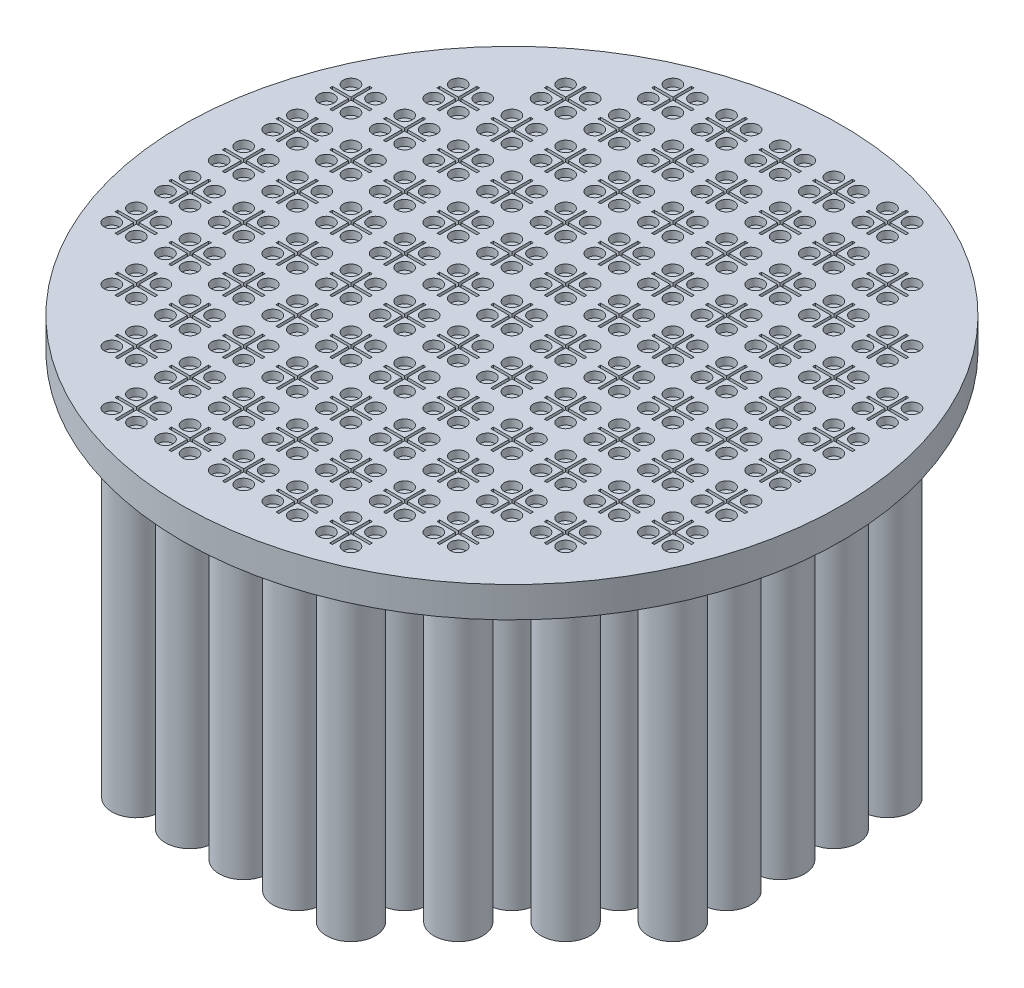
from build123d import *

# Parameters (mm, degrees)
SKETCH_1_R               = 2150
EXTRUDE_1_DEPTH          = 100
SKETCH_3_R               = 140
CUT_EXTRUDE_1_DEPTH      = 3043.203149035
EXTRUDE_START            = 2000
SKETCH_7_R               = 160
SKETCH_7_R_2             = 140
EXTRUDE_3_DEPTH          = 2000
PATTERN_CIRCULAR_1_COUNT = 4
EXTRUDE_START_2          = 100
SKETCH_4_R               = 2150
EXTRUDE_2_DEPTH          = 100
SKETCH_5_W               = 260
SKETCH_5_H               = 17.5
CUT_EXTRUDE_2_DEPTH      = 3755.330832519
SKETCH_6_W               = 17.5
SKETCH_6_H               = 260
CUT_EXTRUDE_3_DEPTH      = 3696.26724338
SKETCH_8_R               = 50
CUT_EXTRUDE_4_DEPTH      = 50
PATTERN_CIRCULAR_3_COUNT = 4


with BuildPart() as part:
    # ｽｹｯﾁ1 → ﾎﾞｽ - 押し出し1 (new body)
    with BuildSketch(Plane(origin=(0, 0, 0), x_dir=(1, 0, 0), z_dir=(0, 1, 0))):
        with Locations(Location((0, 0, 0), (0, 0, 270))):
            Circle(SKETCH_1_R)
    extrude(amount=-EXTRUDE_1_DEPTH)

    # ｽｹｯﾁ3 → ｶｯﾄ - 押し出し1 (cut, through all)
    with BuildSketch(Plane(origin=(0, -100, 0), x_dir=(-1, 0, 0), z_dir=(0, -1, 0))):
        with Locations(Location((0, 0, 0), (0, 0, 90))):
            Circle(SKETCH_3_R)
        with Locations(Location((350, 0, 0), (0, 0, 90))):
            Circle(SKETCH_3_R)
        with Locations(Location((700, 0, 0), (0, 0, 90))):
            Circle(SKETCH_3_R)
        with Locations(Location((1050, 0, 0), (0, 0, 90))):
            Circle(SKETCH_3_R)
        with Locations(Location((1400, 0, 0), (0, 0, 90))):
            Circle(SKETCH_3_R)
        with Locations(Location((1750, 0, 0), (0, 0, 90))):
            Circle(SKETCH_3_R)
        with Locations(Location((350, 350, 0), (0, 0, 90))):
            Circle(SKETCH_3_R)
        with Locations(Location((700, 350, 0), (0, 0, 90))):
            Circle(SKETCH_3_R)
        with Locations(Location((1050, 350, 0), (0, 0, 90))):
            Circle(SKETCH_3_R)
        with Locations(Location((1400, 350, 0), (0, 0, 90))):
            Circle(SKETCH_3_R)
        with Locations(Location((1750, 350, 0), (0, 0, 90))):
            Circle(SKETCH_3_R)
        with Locations(Location((350, 700, 0), (0, 0, 90))):
            Circle(SKETCH_3_R)
        with Locations(Location((700, 700, 0), (0, 0, 90))):
            Circle(SKETCH_3_R)
        with Locations(Location((1050, 700, 0), (0, 0, 90))):
            Circle(SKETCH_3_R)
        with Locations(Location((1400, 700, 0), (0, 0, 90))):
            Circle(SKETCH_3_R)
        with Locations(Location((1750, 700, 0), (0, 0, 90))):
            Circle(SKETCH_3_R)
        with Locations(Location((350, 1050, 0), (0, 0, 90))):
            Circle(SKETCH_3_R)
        with Locations(Location((700, 1050, 0), (0, 0, 90))):
            Circle(SKETCH_3_R)
        with Locations(Location((1050, 1050, 0), (0, 0, 90))):
            Circle(SKETCH_3_R)
        with Locations(Location((1400, 1050, 0), (0, 0, 90))):
            Circle(SKETCH_3_R)
        with Locations(Location((350, 1400, 0), (0, 0, 90))):
            Circle(SKETCH_3_R)
        with Locations(Location((700, 1400, 0), (0, 0, 90))):
            Circle(SKETCH_3_R)
        with Locations(Location((1050, 1400, 0), (0, 0, 90))):
            Circle(SKETCH_3_R)
        with Locations(Location((350, 1750, 0), (0, 0, 90))):
            Circle(SKETCH_3_R)
        with Locations(Location((700, 1750, 0), (0, 0, 90))):
            Circle(SKETCH_3_R)
        with Locations(Location((0, 350, 0), (0, 0, 90))):
            Circle(SKETCH_3_R)
        with Locations(Location((0, 700, 0), (0, 0, 90))):
            Circle(SKETCH_3_R)
        with Locations(Location((0, 1050, 0), (0, 0, 90))):
            Circle(SKETCH_3_R)
        with Locations(Location((0, 1400, 0), (0, 0, 90))):
            Circle(SKETCH_3_R)
        with Locations(Location((0, 1750, 0), (0, 0, 90))):
            Circle(SKETCH_3_R)
    cut_extrude_1 = extrude(amount=-CUT_EXTRUDE_1_DEPTH, mode=Mode.SUBTRACT)

    # ｽｹｯﾁ7 → ﾎﾞｽ - 押し出し3 (add)
    # profile 1 of 30: a face of its own
    with BuildSketch(Plane.XZ.offset(100).offset(EXTRUDE_START)):
        with Locations(Location((0, 0, 0), (0, 0, 90))):
            Circle(SKETCH_7_R)
        with Locations(Location((0, 0, 0), (0, 0, 270))):
            Circle(SKETCH_7_R_2, mode=Mode.SUBTRACT)
    # profile 2 of 30: a face of its own
    with BuildSketch(Plane.XZ.offset(100).offset(EXTRUDE_START)):
        with Locations(Location((-350, 0, 0), (0, 0, 90))):
            Circle(SKETCH_7_R)
        with Locations(Location((-350, 0, 0), (0, 0, 270))):
            Circle(SKETCH_7_R_2, mode=Mode.SUBTRACT)
    # profile 3 of 30: a face of its own
    with BuildSketch(Plane.XZ.offset(100).offset(EXTRUDE_START)):
        with Locations(Location((-700, 0, 0), (0, 0, 90))):
            Circle(SKETCH_7_R)
        with Locations(Location((-700, 0, 0), (0, 0, 270))):
            Circle(SKETCH_7_R_2, mode=Mode.SUBTRACT)
    # profile 4 of 30: a face of its own
    with BuildSketch(Plane.XZ.offset(100).offset(EXTRUDE_START)):
        with Locations(Location((-1050, 0, 0), (0, 0, 90))):
            Circle(SKETCH_7_R)
        with Locations(Location((-1050, 0, 0), (0, 0, 270))):
            Circle(SKETCH_7_R_2, mode=Mode.SUBTRACT)
    # profile 5 of 30: a face of its own
    with BuildSketch(Plane.XZ.offset(100).offset(EXTRUDE_START)):
        with Locations(Location((-1400, 0, 0), (0, 0, 90))):
            Circle(SKETCH_7_R)
        with Locations(Location((-1400, 0, 0), (0, 0, 270))):
            Circle(SKETCH_7_R_2, mode=Mode.SUBTRACT)
    # profile 6 of 30: a face of its own
    with BuildSketch(Plane.XZ.offset(100).offset(EXTRUDE_START)):
        with Locations(Location((-1750, 0, 0), (0, 0, 90))):
            Circle(SKETCH_7_R)
        with Locations(Location((-1750, 0, 0), (0, 0, 270))):
            Circle(SKETCH_7_R_2, mode=Mode.SUBTRACT)
    # profile 7 of 30: a face of its own
    with BuildSketch(Plane.XZ.offset(100).offset(EXTRUDE_START)):
        with Locations(Location((-350, -350, 0), (0, 0, 90))):
            Circle(SKETCH_7_R)
        with Locations(Location((-350, -350, 0), (0, 0, 270))):
            Circle(SKETCH_7_R_2, mode=Mode.SUBTRACT)
    # profile 8 of 30: a face of its own
    with BuildSketch(Plane.XZ.offset(100).offset(EXTRUDE_START)):
        with Locations(Location((-700, -350, 0), (0, 0, 90))):
            Circle(SKETCH_7_R)
        with Locations(Location((-700, -350, 0), (0, 0, 270))):
            Circle(SKETCH_7_R_2, mode=Mode.SUBTRACT)
    # profile 9 of 30: a face of its own
    with BuildSketch(Plane.XZ.offset(100).offset(EXTRUDE_START)):
        with Locations(Location((-1050, -350, 0), (0, 0, 90))):
            Circle(SKETCH_7_R)
        with Locations(Location((-1050, -350, 0), (0, 0, 270))):
            Circle(SKETCH_7_R_2, mode=Mode.SUBTRACT)
    # profile 10 of 30: a face of its own
    with BuildSketch(Plane.XZ.offset(100).offset(EXTRUDE_START)):
        with Locations(Location((-1400, -350, 0), (0, 0, 90))):
            Circle(SKETCH_7_R)
        with Locations(Location((-1400, -350, 0), (0, 0, 270))):
            Circle(SKETCH_7_R_2, mode=Mode.SUBTRACT)
    # profile 11 of 30: a face of its own
    with BuildSketch(Plane.XZ.offset(100).offset(EXTRUDE_START)):
        with Locations(Location((-1750, -350, 0), (0, 0, 90))):
            Circle(SKETCH_7_R)
        with Locations(Location((-1750, -350, 0), (0, 0, 270))):
            Circle(SKETCH_7_R_2, mode=Mode.SUBTRACT)
    # profile 12 of 30: a face of its own
    with BuildSketch(Plane.XZ.offset(100).offset(EXTRUDE_START)):
        with Locations(Location((-350, -700, 0), (0, 0, 90))):
            Circle(SKETCH_7_R)
        with Locations(Location((-350, -700, 0), (0, 0, 270))):
            Circle(SKETCH_7_R_2, mode=Mode.SUBTRACT)
    # profile 13 of 30: a face of its own
    with BuildSketch(Plane.XZ.offset(100).offset(EXTRUDE_START)):
        with Locations(Location((-700, -700, 0), (0, 0, 90))):
            Circle(SKETCH_7_R)
        with Locations(Location((-700, -700, 0), (0, 0, 270))):
            Circle(SKETCH_7_R_2, mode=Mode.SUBTRACT)
    # profile 14 of 30: a face of its own
    with BuildSketch(Plane.XZ.offset(100).offset(EXTRUDE_START)):
        with Locations(Location((-1050, -700, 0), (0, 0, 90))):
            Circle(SKETCH_7_R)
        with Locations(Location((-1050, -700, 0), (0, 0, 270))):
            Circle(SKETCH_7_R_2, mode=Mode.SUBTRACT)
    # profile 15 of 30: a face of its own
    with BuildSketch(Plane.XZ.offset(100).offset(EXTRUDE_START)):
        with Locations(Location((-1400, -700, 0), (0, 0, 90))):
            Circle(SKETCH_7_R)
        with Locations(Location((-1400, -700, 0), (0, 0, 270))):
            Circle(SKETCH_7_R_2, mode=Mode.SUBTRACT)
    # profile 16 of 30: a face of its own
    with BuildSketch(Plane.XZ.offset(100).offset(EXTRUDE_START)):
        with Locations(Location((-1750, -700, 0), (0, 0, 90))):
            Circle(SKETCH_7_R)
        with Locations(Location((-1750, -700, 0), (0, 0, 270))):
            Circle(SKETCH_7_R_2, mode=Mode.SUBTRACT)
    # profile 17 of 30: a face of its own
    with BuildSketch(Plane.XZ.offset(100).offset(EXTRUDE_START)):
        with Locations(Location((-350, -1050, 0), (0, 0, 90))):
            Circle(SKETCH_7_R)
        with Locations(Location((-350, -1050, 0), (0, 0, 270))):
            Circle(SKETCH_7_R_2, mode=Mode.SUBTRACT)
    # profile 18 of 30: a face of its own
    with BuildSketch(Plane.XZ.offset(100).offset(EXTRUDE_START)):
        with Locations(Location((-700, -1050, 0), (0, 0, 90))):
            Circle(SKETCH_7_R)
        with Locations(Location((-700, -1050, 0), (0, 0, 270))):
            Circle(SKETCH_7_R_2, mode=Mode.SUBTRACT)
    # profile 19 of 30: a face of its own
    with BuildSketch(Plane.XZ.offset(100).offset(EXTRUDE_START)):
        with Locations(Location((-1050, -1050, 0), (0, 0, 90))):
            Circle(SKETCH_7_R)
        with Locations(Location((-1050, -1050, 0), (0, 0, 270))):
            Circle(SKETCH_7_R_2, mode=Mode.SUBTRACT)
    # profile 20 of 30: a face of its own
    with BuildSketch(Plane.XZ.offset(100).offset(EXTRUDE_START)):
        with Locations(Location((-1400, -1050, 0), (0, 0, 90))):
            Circle(SKETCH_7_R)
        with Locations(Location((-1400, -1050, 0), (0, 0, 270))):
            Circle(SKETCH_7_R_2, mode=Mode.SUBTRACT)
    # profile 21 of 30: a face of its own
    with BuildSketch(Plane.XZ.offset(100).offset(EXTRUDE_START)):
        with Locations(Location((-350, -1400, 0), (0, 0, 90))):
            Circle(SKETCH_7_R)
        with Locations(Location((-350, -1400, 0), (0, 0, 270))):
            Circle(SKETCH_7_R_2, mode=Mode.SUBTRACT)
    # profile 22 of 30: a face of its own
    with BuildSketch(Plane.XZ.offset(100).offset(EXTRUDE_START)):
        with Locations(Location((-700, -1400, 0), (0, 0, 90))):
            Circle(SKETCH_7_R)
        with Locations(Location((-700, -1400, 0), (0, 0, 270))):
            Circle(SKETCH_7_R_2, mode=Mode.SUBTRACT)
    # profile 23 of 30: a face of its own
    with BuildSketch(Plane.XZ.offset(100).offset(EXTRUDE_START)):
        with Locations(Location((-1050, -1400, 0), (0, 0, 90))):
            Circle(SKETCH_7_R)
        with Locations(Location((-1050, -1400, 0), (0, 0, 270))):
            Circle(SKETCH_7_R_2, mode=Mode.SUBTRACT)
    # profile 24 of 30: a face of its own
    with BuildSketch(Plane.XZ.offset(100).offset(EXTRUDE_START)):
        with Locations(Location((-350, -1750, 0), (0, 0, 90))):
            Circle(SKETCH_7_R)
        with Locations(Location((-350, -1750, 0), (0, 0, 270))):
            Circle(SKETCH_7_R_2, mode=Mode.SUBTRACT)
    # profile 25 of 30: a face of its own
    with BuildSketch(Plane.XZ.offset(100).offset(EXTRUDE_START)):
        with Locations(Location((-700, -1750, 0), (0, 0, 90))):
            Circle(SKETCH_7_R)
        with Locations(Location((-700, -1750, 0), (0, 0, 270))):
            Circle(SKETCH_7_R_2, mode=Mode.SUBTRACT)
    # profile 26 of 30: a face of its own
    with BuildSketch(Plane.XZ.offset(100).offset(EXTRUDE_START)):
        with Locations(Location((0, -350, 0), (0, 0, 90))):
            Circle(SKETCH_7_R)
        with Locations(Location((0, -350, 0), (0, 0, 270))):
            Circle(SKETCH_7_R_2, mode=Mode.SUBTRACT)
    # profile 27 of 30: a face of its own
    with BuildSketch(Plane.XZ.offset(100).offset(EXTRUDE_START)):
        with Locations(Location((0, -700, 0), (0, 0, 90))):
            Circle(SKETCH_7_R)
        with Locations(Location((0, -700, 0), (0, 0, 270))):
            Circle(SKETCH_7_R_2, mode=Mode.SUBTRACT)
    # profile 28 of 30: a face of its own
    with BuildSketch(Plane.XZ.offset(100).offset(EXTRUDE_START)):
        with Locations(Location((0, -1050, 0), (0, 0, 90))):
            Circle(SKETCH_7_R)
        with Locations(Location((0, -1050, 0), (0, 0, 270))):
            Circle(SKETCH_7_R_2, mode=Mode.SUBTRACT)
    # profile 29 of 30: a face of its own
    with BuildSketch(Plane.XZ.offset(100).offset(EXTRUDE_START)):
        with Locations(Location((0, -1400, 0), (0, 0, 90))):
            Circle(SKETCH_7_R)
        with Locations(Location((0, -1400, 0), (0, 0, 270))):
            Circle(SKETCH_7_R_2, mode=Mode.SUBTRACT)
    # profile 30 of 30: a face of its own
    with BuildSketch(Plane.XZ.offset(100).offset(EXTRUDE_START)):
        with Locations(Location((0, -1750, 0), (0, 0, 90))):
            Circle(SKETCH_7_R)
        with Locations(Location((0, -1750, 0), (0, 0, 270))):
            Circle(SKETCH_7_R_2, mode=Mode.SUBTRACT)
    extrude_3 = extrude(amount=-EXTRUDE_3_DEPTH)

    # 円形ﾊﾟﾀｰﾝ1: ｶｯﾄ - 押し出し1, ﾎﾞｽ - 押し出し3 ×4 about axis
    pattern_circular_1_axis = Axis((0, 0, 0), (0, 1, 0))
    add([cut_extrude_1.rotate(pattern_circular_1_axis, i * 360 / PATTERN_CIRCULAR_1_COUNT) for i in range(1, PATTERN_CIRCULAR_1_COUNT)], mode=Mode.SUBTRACT)
    add([extrude_3.rotate(pattern_circular_1_axis, i * 360 / PATTERN_CIRCULAR_1_COUNT) for i in range(1, PATTERN_CIRCULAR_1_COUNT)])

    # ｽｹｯﾁ4 → ﾎﾞｽ - 押し出し2 (add)
    with BuildSketch(Plane(origin=(0, 0, 0), x_dir=(1, 0, 0), z_dir=(0, 1, 0)).offset(EXTRUDE_START_2)):
        with Locations(Location((0, 0, 0), (0, 0, 270))):
            Circle(SKETCH_4_R)
    extrude(amount=-EXTRUDE_2_DEPTH)

    # ｽｹｯﾁ5 → ｶｯﾄ - 押し出し2 (cut, through all)
    with BuildSketch(Plane(origin=(0, 0, 100), x_dir=(1, 0, 0), z_dir=(0, 1, 0))):
        with Locations((0, 100)):
            Rectangle(SKETCH_5_W, SKETCH_5_H)
        with Locations((350, 100)):
            Rectangle(SKETCH_5_W, SKETCH_5_H)
        with Locations((700, 100)):
            Rectangle(SKETCH_5_W, SKETCH_5_H)
        with Locations((1050, 100)):
            Rectangle(SKETCH_5_W, SKETCH_5_H)
        with Locations((1400, 100)):
            Rectangle(SKETCH_5_W, SKETCH_5_H)
        with Locations((1750, 100)):
            Rectangle(SKETCH_5_W, SKETCH_5_H)
        with Locations((350, 450)):
            Rectangle(SKETCH_5_W, SKETCH_5_H)
        with Locations((700, 450)):
            Rectangle(SKETCH_5_W, SKETCH_5_H)
        with Locations((1050, 450)):
            Rectangle(SKETCH_5_W, SKETCH_5_H)
        with Locations((1400, 450)):
            Rectangle(SKETCH_5_W, SKETCH_5_H)
        with Locations((1750, 450)):
            Rectangle(SKETCH_5_W, SKETCH_5_H)
        with Locations((350, 800)):
            Rectangle(SKETCH_5_W, SKETCH_5_H)
        with Locations((700, 800)):
            Rectangle(SKETCH_5_W, SKETCH_5_H)
        with Locations((1050, 800)):
            Rectangle(SKETCH_5_W, SKETCH_5_H)
        with Locations((1400, 800)):
            Rectangle(SKETCH_5_W, SKETCH_5_H)
        with Locations((1750, 800)):
            Rectangle(SKETCH_5_W, SKETCH_5_H)
        with Locations((350, 1150)):
            Rectangle(SKETCH_5_W, SKETCH_5_H)
        with Locations((700, 1150)):
            Rectangle(SKETCH_5_W, SKETCH_5_H)
        with Locations((1050, 1150)):
            Rectangle(SKETCH_5_W, SKETCH_5_H)
        with Locations((1400, 1150)):
            Rectangle(SKETCH_5_W, SKETCH_5_H)
        with Locations((350, 1500)):
            Rectangle(SKETCH_5_W, SKETCH_5_H)
        with Locations((700, 1500)):
            Rectangle(SKETCH_5_W, SKETCH_5_H)
        with Locations((1050, 1500)):
            Rectangle(SKETCH_5_W, SKETCH_5_H)
        with Locations((350, 1850)):
            Rectangle(SKETCH_5_W, SKETCH_5_H)
        with Locations((700, 1850)):
            Rectangle(SKETCH_5_W, SKETCH_5_H)
        with Locations((0, 450)):
            Rectangle(SKETCH_5_W, SKETCH_5_H)
        with Locations((0, 800)):
            Rectangle(SKETCH_5_W, SKETCH_5_H)
        with Locations((0, 1150)):
            Rectangle(SKETCH_5_W, SKETCH_5_H)
        with Locations((0, 1500)):
            Rectangle(SKETCH_5_W, SKETCH_5_H)
        with Locations((0, 1850)):
            Rectangle(SKETCH_5_W, SKETCH_5_H)
    cut_extrude_2 = extrude(amount=CUT_EXTRUDE_2_DEPTH, mode=Mode.SUBTRACT)

    # ｽｹｯﾁ6 → ｶｯﾄ - 押し出し3 (cut, through all)
    with BuildSketch(Plane(origin=(0, 0, 0), x_dir=(1, 0, 0), z_dir=(0, 1, 0))):
        Rectangle(SKETCH_6_W, SKETCH_6_H)
        with Locations((350, 0)):
            Rectangle(SKETCH_6_W, SKETCH_6_H)
        with Locations((700, 0)):
            Rectangle(SKETCH_6_W, SKETCH_6_H)
        with Locations((1050, 0)):
            Rectangle(SKETCH_6_W, SKETCH_6_H)
        with Locations((1400, 0)):
            Rectangle(SKETCH_6_W, SKETCH_6_H)
        with Locations((1750, 0)):
            Rectangle(SKETCH_6_W, SKETCH_6_H)
        with Locations((350, 350)):
            Rectangle(SKETCH_6_W, SKETCH_6_H)
        with Locations((700, 350)):
            Rectangle(SKETCH_6_W, SKETCH_6_H)
        with Locations((1050, 350)):
            Rectangle(SKETCH_6_W, SKETCH_6_H)
        with Locations((1400, 350)):
            Rectangle(SKETCH_6_W, SKETCH_6_H)
        with Locations((1750, 350)):
            Rectangle(SKETCH_6_W, SKETCH_6_H)
        with Locations((350, 700)):
            Rectangle(SKETCH_6_W, SKETCH_6_H)
        with Locations((700, 700)):
            Rectangle(SKETCH_6_W, SKETCH_6_H)
        with Locations((1050, 700)):
            Rectangle(SKETCH_6_W, SKETCH_6_H)
        with Locations((1400, 700)):
            Rectangle(SKETCH_6_W, SKETCH_6_H)
        with Locations((1750, 700)):
            Rectangle(SKETCH_6_W, SKETCH_6_H)
        with Locations((350, 1050)):
            Rectangle(SKETCH_6_W, SKETCH_6_H)
        with Locations((700, 1050)):
            Rectangle(SKETCH_6_W, SKETCH_6_H)
        with Locations((1050, 1050)):
            Rectangle(SKETCH_6_W, SKETCH_6_H)
        with Locations((1400, 1050)):
            Rectangle(SKETCH_6_W, SKETCH_6_H)
        with Locations((350, 1400)):
            Rectangle(SKETCH_6_W, SKETCH_6_H)
        with Locations((700, 1400)):
            Rectangle(SKETCH_6_W, SKETCH_6_H)
        with Locations((1050, 1400)):
            Rectangle(SKETCH_6_W, SKETCH_6_H)
        with Locations((350, 1750)):
            Rectangle(SKETCH_6_W, SKETCH_6_H)
        with Locations((700, 1750)):
            Rectangle(SKETCH_6_W, SKETCH_6_H)
        with Locations((0, 350)):
            Rectangle(SKETCH_6_W, SKETCH_6_H)
        with Locations((0, 700)):
            Rectangle(SKETCH_6_W, SKETCH_6_H)
        with Locations((0, 1050)):
            Rectangle(SKETCH_6_W, SKETCH_6_H)
        with Locations((0, 1400)):
            Rectangle(SKETCH_6_W, SKETCH_6_H)
        with Locations((0, 1750)):
            Rectangle(SKETCH_6_W, SKETCH_6_H)
    cut_extrude_3 = extrude(amount=CUT_EXTRUDE_3_DEPTH, mode=Mode.SUBTRACT)

    # ｽｹｯﾁ8 → ｶｯﾄ - 押し出し4 (cut)
    with BuildSketch(Plane(origin=(0, 100, 0), x_dir=(1, 0, 0), z_dir=(0, 1, 0))):
        with Locations(Location((80, 80, 0), (0, 0, 270))):
            Circle(SKETCH_8_R)
        with Locations(Location((-80, 80, 0), (0, 0, 270))):
            Circle(SKETCH_8_R)
        with Locations(Location((-80, -80, 0), (0, 0, 270))):
            Circle(SKETCH_8_R)
        with Locations(Location((80, -80, 0), (0, 0, 270))):
            Circle(SKETCH_8_R)
        with Locations(Location((270, 80, 0), (0, 0, 270))):
            Circle(SKETCH_8_R)
        with Locations(Location((430, 80, 0), (0, 0, 270))):
            Circle(SKETCH_8_R)
        with Locations(Location((430, -80, 0), (0, 0, 270))):
            Circle(SKETCH_8_R)
        with Locations(Location((270, -80, 0), (0, 0, 270))):
            Circle(SKETCH_8_R)
        with Locations(Location((620, 80, 0), (0, 0, 270))):
            Circle(SKETCH_8_R)
        with Locations(Location((780, 80, 0), (0, 0, 270))):
            Circle(SKETCH_8_R)
        with Locations(Location((780, -80, 0), (0, 0, 270))):
            Circle(SKETCH_8_R)
        with Locations(Location((620, -80, 0), (0, 0, 270))):
            Circle(SKETCH_8_R)
        with Locations(Location((970, 80, 0), (0, 0, 270))):
            Circle(SKETCH_8_R)
        with Locations(Location((1130, 80, 0), (0, 0, 270))):
            Circle(SKETCH_8_R)
        with Locations(Location((1130, -80, 0), (0, 0, 270))):
            Circle(SKETCH_8_R)
        with Locations(Location((970, -80, 0), (0, 0, 270))):
            Circle(SKETCH_8_R)
        with Locations(Location((1320, 80, 0), (0, 0, 270))):
            Circle(SKETCH_8_R)
        with Locations(Location((1480, 80, 0), (0, 0, 270))):
            Circle(SKETCH_8_R)
        with Locations(Location((1480, -80, 0), (0, 0, 270))):
            Circle(SKETCH_8_R)
        with Locations(Location((1320, -80, 0), (0, 0, 270))):
            Circle(SKETCH_8_R)
        with Locations(Location((1670, 80, 0), (0, 0, 270))):
            Circle(SKETCH_8_R)
        with Locations(Location((1830, 80, 0), (0, 0, 270))):
            Circle(SKETCH_8_R)
        with Locations(Location((1830, -80, 0), (0, 0, 270))):
            Circle(SKETCH_8_R)
        with Locations(Location((1670, -80, 0), (0, 0, 270))):
            Circle(SKETCH_8_R)
        with Locations(Location((270, 430, 0), (0, 0, 270))):
            Circle(SKETCH_8_R)
        with Locations(Location((430, 430, 0), (0, 0, 270))):
            Circle(SKETCH_8_R)
        with Locations(Location((430, 270, 0), (0, 0, 270))):
            Circle(SKETCH_8_R)
        with Locations(Location((270, 270, 0), (0, 0, 270))):
            Circle(SKETCH_8_R)
        with Locations(Location((620, 430, 0), (0, 0, 270))):
            Circle(SKETCH_8_R)
        with Locations(Location((780, 430, 0), (0, 0, 270))):
            Circle(SKETCH_8_R)
        with Locations(Location((780, 270, 0), (0, 0, 270))):
            Circle(SKETCH_8_R)
        with Locations(Location((620, 270, 0), (0, 0, 270))):
            Circle(SKETCH_8_R)
        with Locations(Location((970, 430, 0), (0, 0, 270))):
            Circle(SKETCH_8_R)
        with Locations(Location((1130, 430, 0), (0, 0, 270))):
            Circle(SKETCH_8_R)
        with Locations(Location((1130, 270, 0), (0, 0, 270))):
            Circle(SKETCH_8_R)
        with Locations(Location((970, 270, 0), (0, 0, 270))):
            Circle(SKETCH_8_R)
        with Locations(Location((1320, 430, 0), (0, 0, 270))):
            Circle(SKETCH_8_R)
        with Locations(Location((1480, 430, 0), (0, 0, 270))):
            Circle(SKETCH_8_R)
        with Locations(Location((1480, 270, 0), (0, 0, 270))):
            Circle(SKETCH_8_R)
        with Locations(Location((1320, 270, 0), (0, 0, 270))):
            Circle(SKETCH_8_R)
        with Locations(Location((1670, 430, 0), (0, 0, 270))):
            Circle(SKETCH_8_R)
        with Locations(Location((1830, 430, 0), (0, 0, 270))):
            Circle(SKETCH_8_R)
        with Locations(Location((1830, 270, 0), (0, 0, 270))):
            Circle(SKETCH_8_R)
        with Locations(Location((1670, 270, 0), (0, 0, 270))):
            Circle(SKETCH_8_R)
        with Locations(Location((270, 780, 0), (0, 0, 270))):
            Circle(SKETCH_8_R)
        with Locations(Location((430, 780, 0), (0, 0, 270))):
            Circle(SKETCH_8_R)
        with Locations(Location((430, 620, 0), (0, 0, 270))):
            Circle(SKETCH_8_R)
        with Locations(Location((270, 620, 0), (0, 0, 270))):
            Circle(SKETCH_8_R)
        with Locations(Location((620, 780, 0), (0, 0, 270))):
            Circle(SKETCH_8_R)
        with Locations(Location((780, 780, 0), (0, 0, 270))):
            Circle(SKETCH_8_R)
        with Locations(Location((780, 620, 0), (0, 0, 270))):
            Circle(SKETCH_8_R)
        with Locations(Location((620, 620, 0), (0, 0, 270))):
            Circle(SKETCH_8_R)
        with Locations(Location((970, 780, 0), (0, 0, 270))):
            Circle(SKETCH_8_R)
        with Locations(Location((1130, 780, 0), (0, 0, 270))):
            Circle(SKETCH_8_R)
        with Locations(Location((1130, 620, 0), (0, 0, 270))):
            Circle(SKETCH_8_R)
        with Locations(Location((970, 620, 0), (0, 0, 270))):
            Circle(SKETCH_8_R)
        with Locations(Location((1320, 780, 0), (0, 0, 270))):
            Circle(SKETCH_8_R)
        with Locations(Location((1480, 780, 0), (0, 0, 270))):
            Circle(SKETCH_8_R)
        with Locations(Location((1480, 620, 0), (0, 0, 270))):
            Circle(SKETCH_8_R)
        with Locations(Location((1320, 620, 0), (0, 0, 270))):
            Circle(SKETCH_8_R)
        with Locations(Location((1670, 780, 0), (0, 0, 270))):
            Circle(SKETCH_8_R)
        with Locations(Location((1830, 780, 0), (0, 0, 270))):
            Circle(SKETCH_8_R)
        with Locations(Location((1830, 620, 0), (0, 0, 270))):
            Circle(SKETCH_8_R)
        with Locations(Location((1670, 620, 0), (0, 0, 270))):
            Circle(SKETCH_8_R)
        with Locations(Location((270, 1130, 0), (0, 0, 270))):
            Circle(SKETCH_8_R)
        with Locations(Location((430, 1130, 0), (0, 0, 270))):
            Circle(SKETCH_8_R)
        with Locations(Location((430, 970, 0), (0, 0, 270))):
            Circle(SKETCH_8_R)
        with Locations(Location((270, 970, 0), (0, 0, 270))):
            Circle(SKETCH_8_R)
        with Locations(Location((620, 1130, 0), (0, 0, 270))):
            Circle(SKETCH_8_R)
        with Locations(Location((780, 1130, 0), (0, 0, 270))):
            Circle(SKETCH_8_R)
        with Locations(Location((780, 970, 0), (0, 0, 270))):
            Circle(SKETCH_8_R)
        with Locations(Location((620, 970, 0), (0, 0, 270))):
            Circle(SKETCH_8_R)
        with Locations(Location((970, 1130, 0), (0, 0, 270))):
            Circle(SKETCH_8_R)
        with Locations(Location((1130, 1130, 0), (0, 0, 270))):
            Circle(SKETCH_8_R)
        with Locations(Location((1130, 970, 0), (0, 0, 270))):
            Circle(SKETCH_8_R)
        with Locations(Location((970, 970, 0), (0, 0, 270))):
            Circle(SKETCH_8_R)
        with Locations(Location((1320, 1130, 0), (0, 0, 270))):
            Circle(SKETCH_8_R)
        with Locations(Location((1480, 1130, 0), (0, 0, 270))):
            Circle(SKETCH_8_R)
        with Locations(Location((1480, 970, 0), (0, 0, 270))):
            Circle(SKETCH_8_R)
        with Locations(Location((1320, 970, 0), (0, 0, 270))):
            Circle(SKETCH_8_R)
        with Locations(Location((270, 1480, 0), (0, 0, 270))):
            Circle(SKETCH_8_R)
        with Locations(Location((430, 1480, 0), (0, 0, 270))):
            Circle(SKETCH_8_R)
        with Locations(Location((430, 1320, 0), (0, 0, 270))):
            Circle(SKETCH_8_R)
        with Locations(Location((270, 1320, 0), (0, 0, 270))):
            Circle(SKETCH_8_R)
        with Locations(Location((620, 1480, 0), (0, 0, 270))):
            Circle(SKETCH_8_R)
        with Locations(Location((780, 1480, 0), (0, 0, 270))):
            Circle(SKETCH_8_R)
        with Locations(Location((780, 1320, 0), (0, 0, 270))):
            Circle(SKETCH_8_R)
        with Locations(Location((620, 1320, 0), (0, 0, 270))):
            Circle(SKETCH_8_R)
        with Locations(Location((970, 1480, 0), (0, 0, 270))):
            Circle(SKETCH_8_R)
        with Locations(Location((1130, 1480, 0), (0, 0, 270))):
            Circle(SKETCH_8_R)
        with Locations(Location((1130, 1320, 0), (0, 0, 270))):
            Circle(SKETCH_8_R)
        with Locations(Location((970, 1320, 0), (0, 0, 270))):
            Circle(SKETCH_8_R)
        with Locations(Location((270, 1830, 0), (0, 0, 270))):
            Circle(SKETCH_8_R)
        with Locations(Location((430, 1830, 0), (0, 0, 270))):
            Circle(SKETCH_8_R)
        with Locations(Location((430, 1670, 0), (0, 0, 270))):
            Circle(SKETCH_8_R)
        with Locations(Location((270, 1670, 0), (0, 0, 270))):
            Circle(SKETCH_8_R)
        with Locations(Location((620, 1830, 0), (0, 0, 270))):
            Circle(SKETCH_8_R)
        with Locations(Location((780, 1830, 0), (0, 0, 270))):
            Circle(SKETCH_8_R)
        with Locations(Location((780, 1670, 0), (0, 0, 270))):
            Circle(SKETCH_8_R)
        with Locations(Location((620, 1670, 0), (0, 0, 270))):
            Circle(SKETCH_8_R)
        with Locations(Location((-80, 430, 0), (0, 0, 270))):
            Circle(SKETCH_8_R)
        with Locations(Location((80, 430, 0), (0, 0, 270))):
            Circle(SKETCH_8_R)
        with Locations(Location((80, 270, 0), (0, 0, 270))):
            Circle(SKETCH_8_R)
        with Locations(Location((-80, 270, 0), (0, 0, 270))):
            Circle(SKETCH_8_R)
        with Locations(Location((-80, 780, 0), (0, 0, 270))):
            Circle(SKETCH_8_R)
        with Locations(Location((80, 780, 0), (0, 0, 270))):
            Circle(SKETCH_8_R)
        with Locations(Location((80, 620, 0), (0, 0, 270))):
            Circle(SKETCH_8_R)
        with Locations(Location((-80, 620, 0), (0, 0, 270))):
            Circle(SKETCH_8_R)
        with Locations(Location((-80, 1130, 0), (0, 0, 270))):
            Circle(SKETCH_8_R)
        with Locations(Location((80, 1130, 0), (0, 0, 270))):
            Circle(SKETCH_8_R)
        with Locations(Location((80, 970, 0), (0, 0, 270))):
            Circle(SKETCH_8_R)
        with Locations(Location((-80, 970, 0), (0, 0, 270))):
            Circle(SKETCH_8_R)
        with Locations(Location((-80, 1480, 0), (0, 0, 270))):
            Circle(SKETCH_8_R)
        with Locations(Location((80, 1480, 0), (0, 0, 270))):
            Circle(SKETCH_8_R)
        with Locations(Location((80, 1320, 0), (0, 0, 270))):
            Circle(SKETCH_8_R)
        with Locations(Location((-80, 1320, 0), (0, 0, 270))):
            Circle(SKETCH_8_R)
        with Locations(Location((-80, 1830, 0), (0, 0, 270))):
            Circle(SKETCH_8_R)
        with Locations(Location((80, 1830, 0), (0, 0, 270))):
            Circle(SKETCH_8_R)
        with Locations(Location((80, 1670, 0), (0, 0, 270))):
            Circle(SKETCH_8_R)
        with Locations(Location((-80, 1670, 0), (0, 0, 270))):
            Circle(SKETCH_8_R)
    cut_extrude_4 = extrude(amount=-CUT_EXTRUDE_4_DEPTH, mode=Mode.SUBTRACT)

    # 円形ﾊﾟﾀｰﾝ3: ｶｯﾄ - 押し出し2, ｶｯﾄ - 押し出し3, ｶｯﾄ - 押し出し4 ×4 about axis
    pattern_circular_3_axis = Axis((0, 0, 0), (0, 1, 0))
    add([cut_extrude_2.rotate(pattern_circular_3_axis, i * 360 / PATTERN_CIRCULAR_3_COUNT) for i in range(1, PATTERN_CIRCULAR_3_COUNT)], mode=Mode.SUBTRACT)
    add([cut_extrude_3.rotate(pattern_circular_3_axis, i * 360 / PATTERN_CIRCULAR_3_COUNT) for i in range(1, PATTERN_CIRCULAR_3_COUNT)], mode=Mode.SUBTRACT)
    add([cut_extrude_4.rotate(pattern_circular_3_axis, i * 360 / PATTERN_CIRCULAR_3_COUNT) for i in range(1, PATTERN_CIRCULAR_3_COUNT)], mode=Mode.SUBTRACT)


solid = part.part
